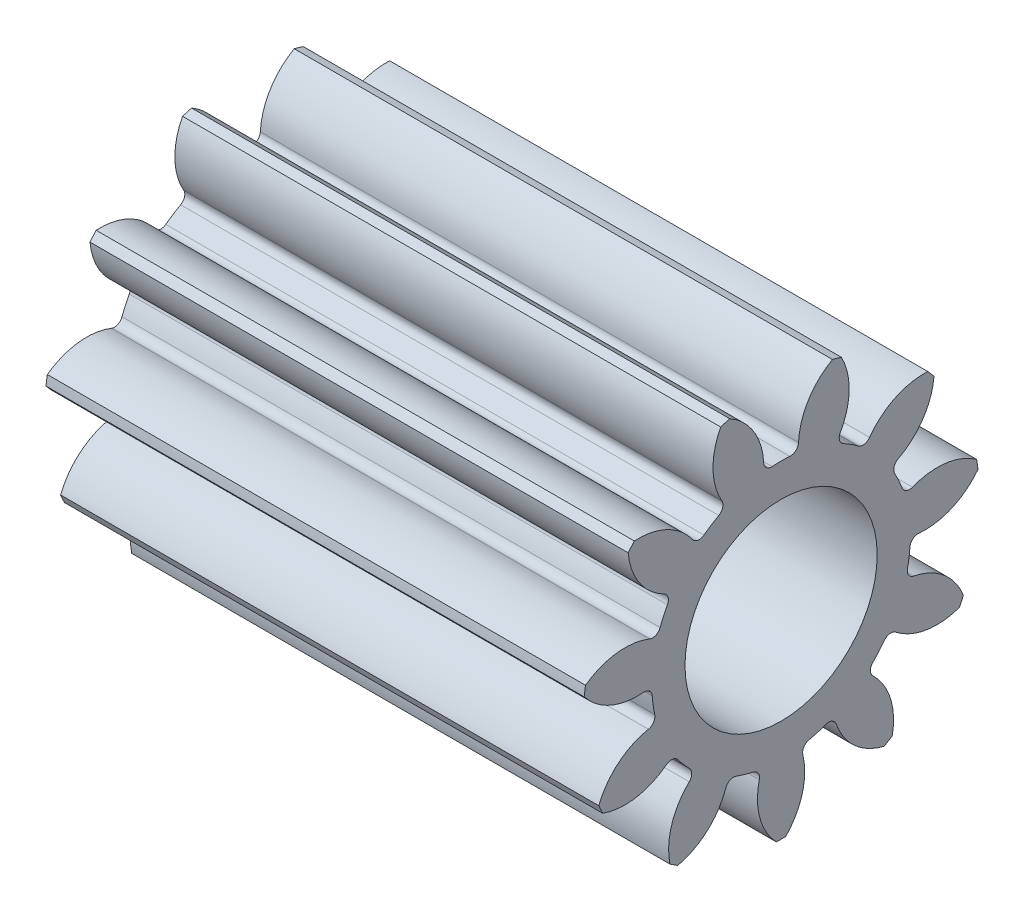
from build123d import *

# Parameters (mm, degrees)
BASPROSKE_W                = 13.99999994
BASPROSKE_H                = 5.159375
TOOTHCUT_DEPTH             = 16.787282828
ROOTFILLETS_R              = 0.20955
TEETHCUTS_COUNT            = 11
TEETHCUTS_ANGLE            = 327.272727273
ROOTFILLETS_OF_TEETHCUTS_R = 0.20955
CUT_EXTRUDE1_REACH         = 17.775
SKETCH1_R                  = 2.499999953


with BuildPart() as part:
    # BasProSke → Base-Revolve (revolve)
    with BuildSketch(Plane(origin=(0, 0, 0), x_dir=(1, 0, 0), z_dir=(0, 1, 0))):
        with Locations((6.99999997, 2.5796875)):
            Rectangle(BASPROSKE_W, BASPROSKE_H)
    revolve(axis=Axis((-10, 0, 0), (1, 0, 0)))

    # TooCutSke → ToothCut (cut, through all)
    with BuildSketch(Plane(origin=(0, 0, 0), x_dir=(0, 0, -1), z_dir=(1, 0, 0))):
        with BuildLine():
            ThreePointArc((0.455692995, 3.331302043), (0, 3.362325), (-0.455692995, 3.331302043))
            ThreePointArc((-0.455692995, 3.331302043), (-0.66414347, 4.301321709), (-1.3673759, 5.001217347))
            ThreePointArc((-1.3673759, 5.001217347), (0, 5.184775), (1.3673759, 5.001217347))
            ThreePointArc((1.3673759, 5.001217347), (0.66414347, 4.301321709), (0.455692995, 3.331302043))
        make_face()
    toothcut = extrude(amount=TOOTHCUT_DEPTH, mode=Mode.SUBTRACT)

    # RootFillets
    rootfillets_edges = [part.edges().sort_by_distance(p)[0] for p in [
        (6.99999997, 3.331302043, -0.455692995),
        (6.99999997, 3.331302043, 0.455692995),
    ]]
    fillet(rootfillets_edges, radius=ROOTFILLETS_R)

    # TeethCuts: ToothCut ×11 about axis
    teethcuts_axis = Axis((-10, 0, 0), (1, 0, 0))
    for i in range(1, TEETHCUTS_COUNT):
        add(toothcut.rotate(teethcuts_axis, i * TEETHCUTS_ANGLE / (TEETHCUTS_COUNT - 1)), mode=Mode.SUBTRACT)

    # RootFillets of TeethCuts
    rootfillets_of_teethcuts_edges = [part.edges().sort_by_distance(p)[0] for p in [
        (6.99999997, 3.048835846, 1.417684518),
        (6.99999997, 2.556103379, 2.184391201),
        (6.99999997, 1.798385809, 2.840957213),
        (6.99999997, 0.969359954, 3.219560636),
        (6.99999997, -0.023039015, 3.362246066),
        (6.99999997, -0.925148408, 3.232542317),
        (6.99999997, -1.837149114, 2.81604555),
        (6.99999997, -2.525928687, 2.219214652),
        (6.99999997, -3.067977351, 1.375770469),
        (6.99999997, -3.324744456, 0.501302016),
        (6.99999997, -3.324744456, -0.501302016),
        (6.99999997, -3.067977351, -1.375770469),
        (6.99999997, -2.525928687, -2.219214652),
        (6.99999997, -1.837149114, -2.81604555),
        (6.99999997, -0.925148408, -3.232542317),
        (6.99999997, -0.023039015, -3.362246066),
        (6.99999997, 0.969359954, -3.219560636),
        (6.99999997, 1.798385809, -2.840957213),
        (6.99999997, 2.556103379, -2.184391201),
        (6.99999997, 3.048835846, -1.417684518),
    ]]
    fillet(rootfillets_of_teethcuts_edges, radius=ROOTFILLETS_OF_TEETHCUTS_R)

    # Sketch1 → Cut-Extrude1 (cut, up to next)
    with BuildSketch(Plane(origin=(13.99999994, 0, 0), x_dir=(0, 0, -1), z_dir=(1, 0, 0)), mode=Mode.PRIVATE) as cut_extrude1_sk1:
        Circle(SKETCH1_R)
    cut_extrude1_tool1 = extrude(cut_extrude1_sk1.sketch, amount=-CUT_EXTRUDE1_REACH, mode=Mode.PRIVATE) & part.part
    add(cut_extrude1_tool1.solids().sort_by_distance((14, 0, 0))[0], mode=Mode.SUBTRACT)


solid = part.part
